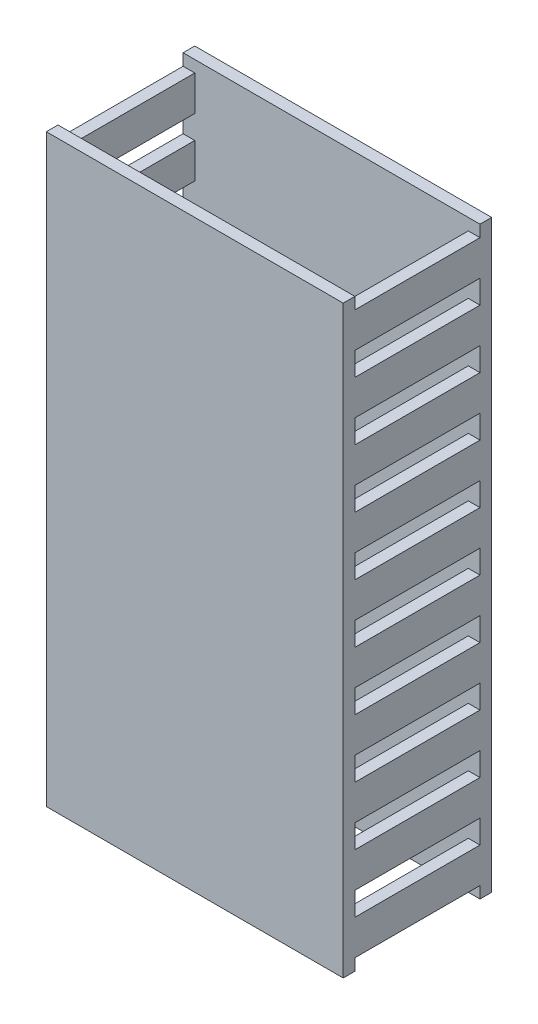
from build123d import *

# Parameters (mm, degrees)
SKETCH1_W            = 50.8
SKETCH1_H            = 25.4
SKETCH1_W_2          = 46.8
SKETCH1_H_2          = 21.4
BOSS_EXTRUDE1_DEPTH  = 50
SKETCH2_W            = 21.4
SKETCH2_H            = 4
CUT_EXTRUDE1_DEPTH   = 76.669016116
LPATTERN1_COUNT      = 6
LPATTERN1_PITCH      = 10
LPATTERN1_COUNT_DIR2 = 6
LPATTERN1_PITCH_DIR2 = 10


with BuildPart() as part:
    # Sketch1 → Boss-Extrude1 (new, symmetric)
    with BuildSketch(Plane(origin=(0, 0, 0), x_dir=(1, 0, 0), z_dir=(0, 1, 0))):
        with Locations((25.4, 12.7)):
            Rectangle(SKETCH1_W, SKETCH1_H)
        with Locations((25.4, 12.7)):
            Rectangle(SKETCH1_W_2, SKETCH1_H_2, mode=Mode.SUBTRACT)
    extrude(amount=BOSS_EXTRUDE1_DEPTH, both=True)

    # Sketch2 → Cut-Extrude1 (cut, through all)
    with BuildSketch(Plane(origin=(50.8, 0, 0), x_dir=(0, 0, -1), z_dir=(1, 0, 0))):
        with Locations((12.7, 0)):
            Rectangle(SKETCH2_W, SKETCH2_H)
    cut_extrude1 = extrude(amount=-CUT_EXTRUDE1_DEPTH, mode=Mode.SUBTRACT)

    # LPattern1: Cut-Extrude1 6 × 6
    with Locations(*[Vector(0, -1, 0) * (i * LPATTERN1_PITCH) + Vector(0, 1, 0) * (j * LPATTERN1_PITCH_DIR2) for i in range(LPATTERN1_COUNT) for j in range(LPATTERN1_COUNT_DIR2) if (i, j) != (0, 0)]):
        add(cut_extrude1, mode=Mode.SUBTRACT)


solid = part.part
